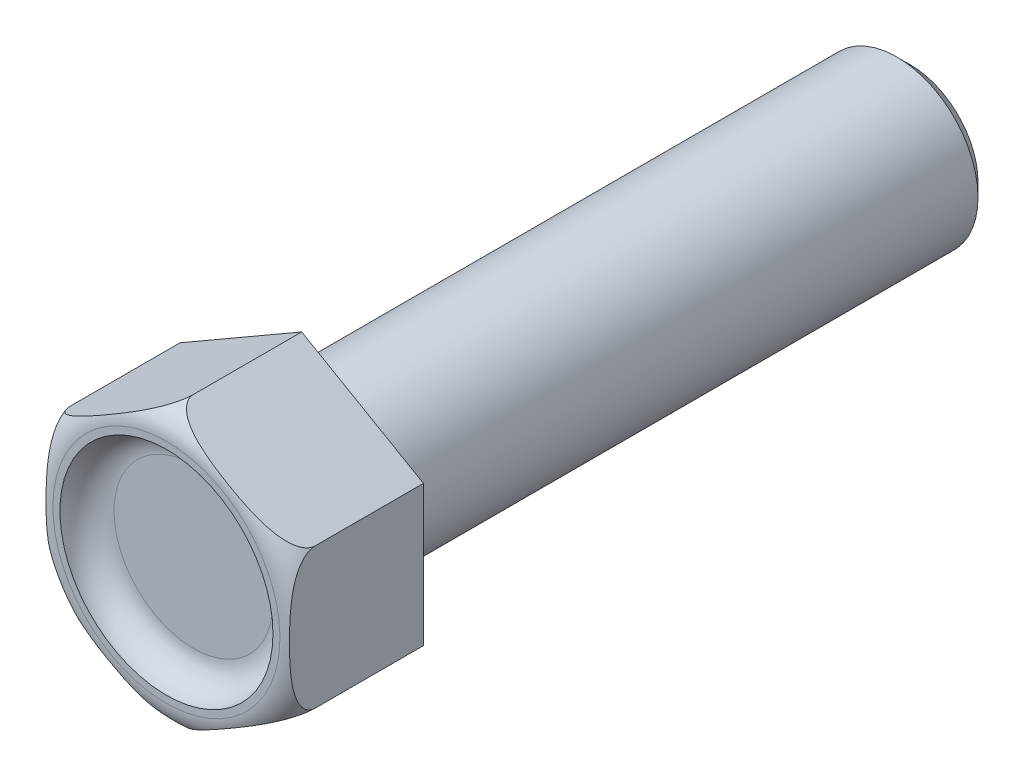
from build123d import *

# Parameters (mm, degrees)
BOSS_EXTRUDE1_DEPTH = 10
SKETCH4_R           = 6
BOSS_EXTRUDE2_DEPTH = 45
CHAMFER1_SIZE       = 1
FILLET1_R           = 0.5
SKETCH6_R           = 7.875
CUT_EXTRUDE1_DEPTH  = 2
FILLET2_R           = 2


with BuildPart() as part:
    # Sketch3 → Boss-Extrude1 (new body)
    with BuildSketch(Plane.XY):
        Polygon((0, 10.392304845), (-9, 5.196152423), (-9, -5.196152423), (0, -10.392304845), (9, -5.196152423), (9, 5.196152423), align=None)
    extrude(amount=BOSS_EXTRUDE1_DEPTH)

    # Sketch4 → Boss-Extrude2 (add)
    with BuildSketch(Plane(origin=(0, 0, 0), x_dir=(-1, 0, 0), z_dir=(0, 0, -1))):
        with Locations(Location((0, 0, 0), (0, 0, 180))):
            Circle(SKETCH4_R)
    extrude(amount=BOSS_EXTRUDE2_DEPTH)

    # Chamfer1
    chamfer1_edges = [part.edges().sort_by_distance(p)[0] for p in [
        (-6, 0, -45),
    ]]
    chamfer(chamfer1_edges, length=CHAMFER1_SIZE)

    # Fillet1
    fillet1_edges = [part.edges().sort_by_distance(p)[0] for p in [
        (-6, 0, 0),
    ]]
    fillet(fillet1_edges, radius=FILLET1_R)

    # Sketch5 → Cut-Revolve1 (revolve, cut)
    with BuildSketch(Plane(origin=(0, 0, 0), x_dir=(0, 0, -1), z_dir=(1, 0, 0))):
        with BuildLine():
            Line((-8, 10.392304845), (-10, 10.392304845))
            Line((-10, 10.392304845), (-10, 8.392304845))
            ThreePointArc((-10, 8.392304845), (-9.414213562, 9.806518408), (-8, 10.392304845))
        make_face()
    revolve(axis=Axis((0, 0, 0), (0, 0, 1)), mode=Mode.SUBTRACT)

    # Sketch6 → Cut-Extrude1 (cut)
    with BuildSketch(Plane.XY.offset(10)):
        Circle(SKETCH6_R)
    extrude(amount=-CUT_EXTRUDE1_DEPTH, mode=Mode.SUBTRACT)

    # Fillet2
    fillet2_edges = [part.edges().sort_by_distance(p)[0] for p in [
        (-7.875, 0, 8),
    ]]
    fillet(fillet2_edges, radius=FILLET2_R - 0.0001)  # a hair under: the kernel refuses the full size


solid = part.part
